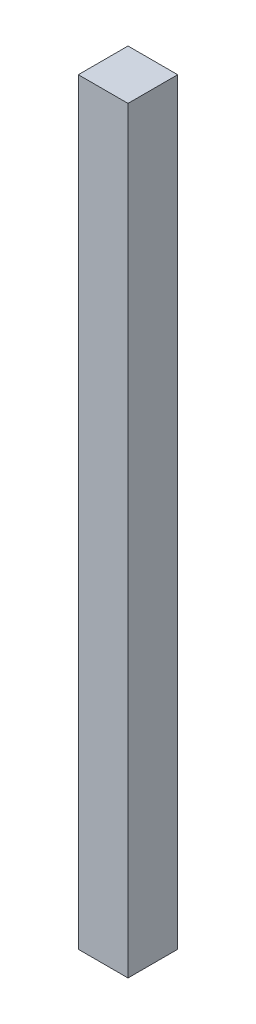
from build123d import *

# Parameters (mm, degrees)
SKETCH1_W           = 25.4
SKETCH1_H           = 25.4
BOSS_EXTRUDE1_DEPTH = 387.096


with BuildPart() as part:
    # Sketch1 → Boss-Extrude1 (new body)
    with BuildSketch(Plane(origin=(0, 0, 0), x_dir=(1, 0, 0), z_dir=(0, 1, 0))):
        with Locations((12.7, 12.7)):
            Rectangle(SKETCH1_W, SKETCH1_H)
    extrude(amount=BOSS_EXTRUDE1_DEPTH)


solid = part.part
